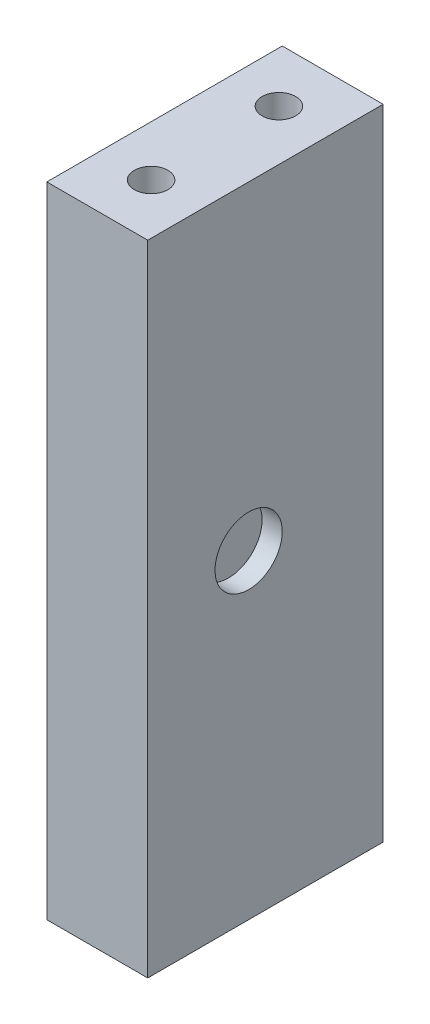
from build123d import *

# Parameters (mm, degrees)
SKETCH1_W           = 15
SKETCH1_H           = 35
SKETCH1_R           = 2.5
BOSS_EXTRUDE1_DEPTH = 47.5
SKETCH2_R           = 5
CUT_EXTRUDE1_DEPTH  = 3


with BuildPart() as part:
    # Sketch1 → Boss-Extrude1 (new, symmetric)
    with BuildSketch(Plane(origin=(0, 0, 0), x_dir=(1, 0, 0), z_dir=(0, 1, 0))):
        Rectangle(SKETCH1_W, SKETCH1_H)
        with Locations((0, 9.5)):
            Circle(SKETCH1_R, mode=Mode.SUBTRACT)
        with Locations((0, -9.5)):
            Circle(SKETCH1_R, mode=Mode.SUBTRACT)
    extrude(amount=BOSS_EXTRUDE1_DEPTH, both=True)

    # Sketch2 → Cut-Extrude1 (cut)
    with BuildSketch(Plane(origin=(7.5, 0, 0), x_dir=(0, 0, -1), z_dir=(1, 0, 0))):
        with Locations((-2.5, 0)):
            Circle(SKETCH2_R)
    extrude(amount=-CUT_EXTRUDE1_DEPTH, mode=Mode.SUBTRACT)


solid = part.part
